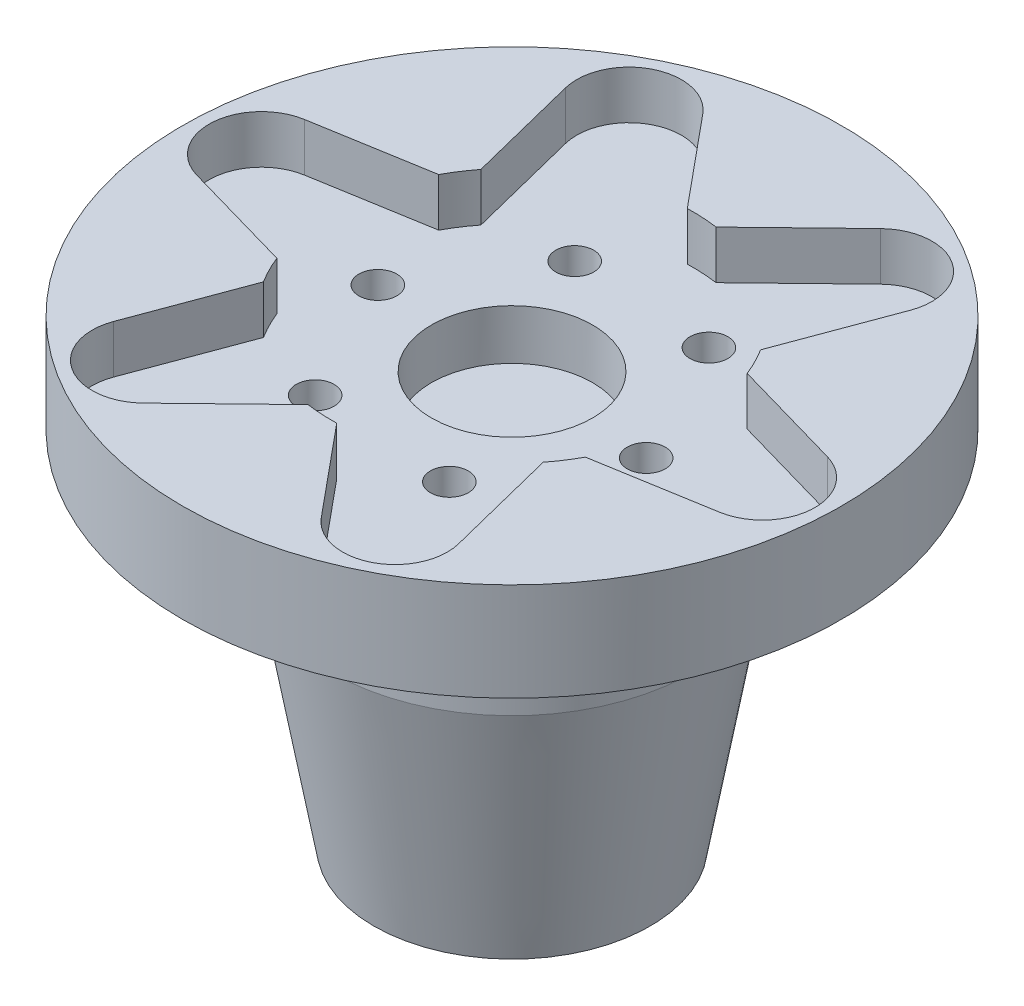
from build123d import *

# Parameters (mm, degrees)
SKETCH1_R                 = 17.37527472527474
BOSS_EXTRUDE1_DEPTH       = 2.54
BOSS_EXTRUDE2_START       = -5.175
BOSS_EXTRUDE2_OUTLINE_R   = 17.375274725
BOSS_EXTRUDE2_OUTLINE_R_2 = 1
BOSS_EXTRUDE2_OUTLINE_R_3 = 4.25
BOSS_EXTRUDE2_DEPTH       = 2.635
SKETCH2_R                 = 9.525
BOSS_EXTRUDE4_DEPTH       = 19.05
CHAMFER1_SIZE             = 12.7
CHAMFER1_SIZE2            = 2.23935265499751


# Read off the part's stored shape, not the designer's step: Boss-Extrude2
with BuildPart() as part:
    # Sketch1 → Boss-Extrude1 (new body)
    with BuildSketch(Plane(origin=(0, 325.36739999999986, 0), x_dir=(1, 0, 0), z_dir=(0, 1, 0))):
        with Locations(Location((0, 3.66e-14, 0), (0, 0, 270))):
            Circle(SKETCH1_R)
        with BuildLine():
            Line((-8.83112529829345, -3.568872506245661), (-14.736178288860136, -1.88495193133948))
            ThreePointArc((-14.736178288860136, -1.8849519313394787), (-16.73655161171898, 0.9233006813963234), (-14.43941301600355, 3.49447365103826))
            Line((-14.43941301600355, 3.4944736510382595), (-8.384964425073763, 4.51862773308911))
            ThreePointArc((-8.384964425073935, 4.518627733089421), (-7.974035718754682, 5.209642920203345), (-7.506296902423261, 5.863542599203262))
            Line((-7.506296902423427, 5.863542599203276), (-9.000505401882572, 11.81942878717986))
            ThreePointArc((-9.000505401882574, 11.81942878717986), (-7.5686739604387565, 14.955929208196205), (-4.1934035533472525, 14.25213531311389))
            Line((-4.193403553347251, 14.25213531311389), (-0.2792358054370207, 9.520906068487482))
            ThreePointArc((-0.27923580543699295, 9.520906068487529), (0.5246652541642909, 9.510538963227763), (1.3248283958705547, 9.432415105448642))
            Line((1.3248283958705054, 9.432415105448754), (5.7356728869774125, 13.70438071851937))
            ThreePointArc((5.7356728869774125, 13.70438071851937), (9.16787765128006, 14.03262852679995), (10.246009462656167, 10.75766166207572))
            Line((10.246009462656167, 10.75766166207572), (8.1057286196369, 5.0022783353981914))
            ThreePointArc((8.105728619637244, 5.002278335398186), (8.498700972919012, 4.300896043024725), (8.831125298293639, 3.5688725062459628))
            Line((8.831125298293461, 3.5688725062457136), (14.736178288860124, 1.884951931339582))
            ThreePointArc((14.736178288860126, 1.8849519313395824), (16.736551611718987, -0.9233006813962088), (14.43941301600357, -3.494473651038158))
            Line((14.43941301600357, -3.4944736510381578), (8.384964425073758, -4.518627733089059))
            ThreePointArc((8.384964425073925, -4.518627733089367), (7.974035718754691, -5.20964292020326), (7.506296902423297, -5.863542599203144))
            Line((7.5062969024234505, -5.863542599203156), (9.000505401882656, -11.8194287871798))
            ThreePointArc((9.000505401882656, -11.8194287871798), (7.568673960438859, -14.955929208196153), (4.193403553347351, -14.252135313113861))
            Line((4.193403553347352, -14.252135313113861), (0.2792358054370711, -9.520906068487413))
            ThreePointArc((0.2792358054370489, -9.520906068487452), (-0.5246652541641907, -9.510538963227694), (-1.3248283958704137, -9.432415105448587))
            Line((-1.3248283958703642, -9.432415105448698), (-5.735672886977412, -13.70438071851937))
            ThreePointArc((-5.7356728869774125, -13.70438071851937), (-9.167877651280058, -14.032628526799948), (-10.246009462656165, -10.75766166207572))
            Line((-10.246009462656165, -10.75766166207572), (-8.105728619636901, -5.002278335398116))
            ThreePointArc((-8.105728619637246, -5.002278335398109), (-8.498700972919007, -4.300896043024661), (-8.83112529829363, -3.56887250624591))
        make_face(mode=Mode.SUBTRACT)
    extrude(amount=-BOSS_EXTRUDE1_DEPTH)

    # Boss-Extrude2 outline → Boss-Extrude2 (add)
    with BuildSketch(Plane(origin=(0, 325.36739999999986, 0), x_dir=(1, 0, 0), z_dir=(0, 1, 0)).offset(BOSS_EXTRUDE2_START)):
        Circle(BOSS_EXTRUDE2_OUTLINE_R)
        with Locations((-4.10208104, -6.278768282)):
            Circle(BOSS_EXTRUDE2_OUTLINE_R_2, mode=Mode.SUBTRACT)
        with Locations((3.386532317, -6.69189053)):
            Circle(BOSS_EXTRUDE2_OUTLINE_R_2, mode=Mode.SUBTRACT)
        with Locations((7.488613357, -0.413122247)):
            Circle(BOSS_EXTRUDE2_OUTLINE_R_2, mode=Mode.SUBTRACT)
        with Locations((-7.488613357, 0.413122247)):
            Circle(BOSS_EXTRUDE2_OUTLINE_R_2, mode=Mode.SUBTRACT)
        with Locations((-3.386532317, 6.69189053)):
            Circle(BOSS_EXTRUDE2_OUTLINE_R_2, mode=Mode.SUBTRACT)
        Circle(BOSS_EXTRUDE2_OUTLINE_R_3, mode=Mode.SUBTRACT)
        with Locations((4.10208104, 6.278768282)):
            Circle(BOSS_EXTRUDE2_OUTLINE_R_2, mode=Mode.SUBTRACT)
    extrude(amount=BOSS_EXTRUDE2_DEPTH)

    # Sketch2 → Boss-Extrude4 (add)
    with BuildSketch(Plane.XZ.offset(-320.19239999999985)):
        with Locations(Location((0, 0, 0), (0, 0, 90))):
            Circle(SKETCH2_R)
    extrude(amount=BOSS_EXTRUDE4_DEPTH)

    # Chamfer1
    chamfer1_edges = [part.edges().sort_by_distance(p)[0] for p in [
        (-1.75e-15, 301.14239999999984, -9.525),
    ]]
    chamfer1_side = [part.faces().sort_by_distance(p)[0] for p in [
        (-1.75e-15, 310.6673999999999, -9.525),
    ]]
    chamfer(chamfer1_edges, length=CHAMFER1_SIZE, length2=CHAMFER1_SIZE2, reference=chamfer1_side[0])


solid = part.part
